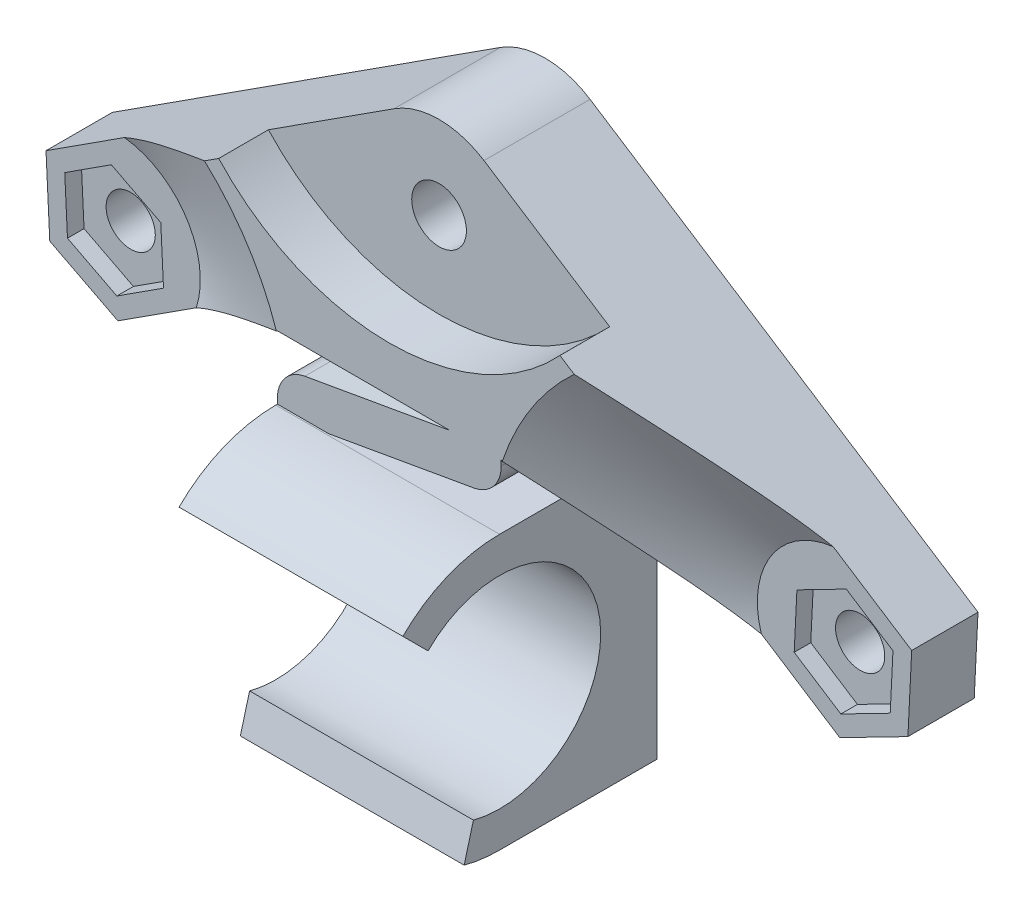
from build123d import *

# Parameters (mm, degrees)
BOSS_EXTRUDE1_DEPTH = 13.5
CUT_EXTRUDE1_DEPTH  = 19.454335534
SKETCH14_R          = 1.65
SKETCH14_R_2        = 1.483994527
BOSS_EXTRUDE3_DEPTH = 9.4
CUT_EXTRUDE7_DEPTH  = 43.344584395
FILLET2_R           = 2
CUT_EXTRUDE8_DEPTH  = 4
CUT_EXTRUDE9_DEPTH  = 5.4
CHAMFER2_SIZE       = 12
CHAMFER2_SIZE_2     = 6
CHAMFER3_SIZE       = 6
CHAMFER3_SIZE_2     = 12
SKETCH18_R          = 14.026707194
CUT_EXTRUDE10_DEPTH = 3
CUT_EXTRUDE11_DEPTH = 1


with BuildPart() as part:
    # Sketch1 → Boss-Extrude1 (new body)
    with BuildSketch(Plane.ZY):
        with BuildLine():
            Line((-9.5, 8.25), (-9.5, -8.25))
            Line((-9.5, -8.25), (0, -8.25))
            ThreePointArc((0, -8.25), (8.25, 0), (0, 8.25))
            Line((0, 8.25), (-9.5, 8.25))
        make_face()
    extrude(amount=BOSS_EXTRUDE1_DEPTH)

    # Sketch7 → Cut-Extrude1 (cut, through all)
    with BuildSketch(Plane.ZY.offset(13.5)):
        with BuildLine():
            Line((13.481907846, 13.481907846), (4.313351365, 4.313351365))
            ThreePointArc((4.313351365, 4.313351365), (-5.89214754, 1.578796175), (1.578796175, -5.89214754))
            Line((1.578796175, -5.89214754), (4.934720763, -18.416628609))
            Line((4.934720763, -18.416628609), (13.481907846, 13.481907846))
        make_face()
    extrude(amount=-CUT_EXTRUDE1_DEPTH, mode=Mode.SUBTRACT)

    # Sketch14 → Boss-Extrude3 (add)
    with BuildSketch(Plane(origin=(0, 0, -9.5), x_dir=(-1, 0, 0), z_dir=(0, 0, -1))):
        with BuildLine():
            Line((4.039848555, 24.201794753), (-19.358847021, 9.109670469))
            Line((-19.358847021, 9.109670469), (-19.131451731, 4.496469334))
            Line((-19.131451731, 4.496469334), (-15.022604709, 2.386798865))
            Line((-15.022604709, 2.386798865), (0, 12.07635684))
            Line((0, 12.07635684), (0, 8.25))
            Line((0, 8.25), (13.5, 8.25))
            Line((13.5, 8.25), (13.5, 12.07635684))
            Line((13.5, 12.07635684), (28.522604709, 2.386798865))
            Line((28.522604709, 2.386798865), (32.631451731, 4.496469334))
            Line((32.631451731, 4.496469334), (32.858847021, 9.109670469))
            Line((32.858847021, 9.109670469), (9.460151445, 24.201794753))
            ThreePointArc((9.460151445, 24.201794753), (6.75, 25), (4.039848555, 24.201794753))
        make_face()
        with Locations((6.75, 20)):
            Circle(SKETCH14_R, mode=Mode.SUBTRACT)
        with Locations((-15.25, 7)):
            Circle(SKETCH14_R_2, mode=Mode.SUBTRACT)
        with Locations(Location((28.75, 7, 0), (0, 0, 180))):
            Circle(SKETCH14_R_2, mode=Mode.SUBTRACT)
    extrude(amount=-BOSS_EXTRUDE3_DEPTH)

    # Sketch15 → Cut-Extrude7 (cut, through all)
    with BuildSketch(Plane.XY.offset(-0.1)):
        Polygon((0, 8.25), (-10.401710887, 8.25), (0, 10.084102275), align=None)
        Polygon((-13.5, 10.242254565), (-13.5, 12.07635684), (-3.098289113, 12.07635684), align=None)
    extrude(amount=-CUT_EXTRUDE7_DEPTH, mode=Mode.SUBTRACT)

    # Fillet2
    fillet2_edges = [part.edges().sort_by_distance(p)[0] for p in [
        (0, 10.084102275, -4.8),
        (-13.5, 10.242254565, -4.8),
    ]]
    fillet(fillet2_edges, radius=FILLET2_R)

    # Sketch16 → Cut-Extrude8 (cut)
    with BuildSketch(Plane(origin=(0, 0, -9.5), x_dir=(-1, 0, 0), z_dir=(0, 0, -1))):
        Polygon((6.75, 16.651368439), (9.65, 18.325684219), (9.65, 21.674315781), (6.75, 23.348631561), (3.85, 21.674315781), (3.85, 18.325684219), align=None)
    extrude(amount=-CUT_EXTRUDE8_DEPTH, mode=Mode.SUBTRACT)

    # Sketch17 → Cut-Extrude9 (cut)
    with BuildSketch(Plane.XY.offset(-0.1)):
        with BuildLine():
            Line((19.131451731, 4.496469334), (19.358847021, 9.109670469))
            Line((19.358847021, 9.109670469), (17.418121156, 10.361435802))
            ThreePointArc((17.418121156, 10.361435802), (11.888564198, 9.168121156), (13.081878844, 3.638564198))
            Line((13.081878844, 3.638564198), (15.022604709, 2.386798865))
            Line((15.022604709, 2.386798865), (19.131451731, 4.496469334))
        make_face()
        with BuildLine():
            Line((-32.631451731, 4.496469334), (-28.522604709, 2.386798865))
            Line((-28.522604709, 2.386798865), (-26.581878844, 3.638564198))
            ThreePointArc((-26.581878844, 3.638564198), (-25.388564198, 9.168121156), (-30.918121156, 10.361435802))
            Line((-30.918121156, 10.361435802), (-32.858847021, 9.109670469))
            Line((-32.858847021, 9.109670469), (-32.631451731, 4.496469334))
        make_face()
    extrude(amount=-CUT_EXTRUDE9_DEPTH, mode=Mode.SUBTRACT)

    # Chamfer2
    # the kernel refuses this chamfer: 12, 6 mm, written as the material it takes off along each edge
    with BuildSketch(Plane(origin=(-28.75, 7, -0.1), x_dir=(-0.8386519680093931, -0.5446676753342096, 0), z_dir=(-0.5446676753342096, 0.8386519680093931, 0))) as chamfer2_piece_1_section:
        Polygon((4 + CHAMFER2_SIZE, 0), (4, -CHAMFER2_SIZE_2), (4, 0), align=None)
    chamfer2_piece_1 = revolve(axis=Axis((-28.75, 7, -0.1), (0, 0, 1)), revolution_arc=359.64, mode=Mode.PRIVATE)
    chamfer2_piece_1 = split(chamfer2_piece_1, bisect_by=Plane(origin=(-24.520519127, 4.968138188, -1.544016366), z_dir=(-0.5420302889814643, 0.8403589505840171, 0)), keep=Keep.TOP, mode=Mode.PRIVATE)
    chamfer2_piece_1 = split(chamfer2_piece_1, bisect_by=Plane(origin=(-24.679235885, 5.214211241, -5.5), z_dir=(0, 0, 1)), keep=Keep.TOP, mode=Mode.PRIVATE)
    add(chamfer2_piece_1, mode=Mode.SUBTRACT)

    # Chamfer3
    # the kernel refuses this chamfer: 12, 6 mm, written as the material it takes off along each edge
    with BuildSketch(Plane(origin=(15.25, 7, -0.1), x_dir=(0.8420576391550663, -0.5393875530085916, 0), z_dir=(-0.5393875530085916, -0.8420576391550663, 0))) as chamfer3_piece_1_section:
        Polygon((4, -CHAMFER3_SIZE), (4 + CHAMFER3_SIZE_2, 0), (4, 0), align=None)
    chamfer3_piece_1 = revolve(axis=Axis((15.25, 7, -0.1), (0, 0, 1)), revolution_arc=359.64, mode=Mode.PRIVATE)
    chamfer3_piece_1 = split(chamfer3_piece_1, bisect_by=Plane(origin=(8.890128565, 11.795128101, -5.5), z_dir=(0, 0, 1)), keep=Keep.TOP, mode=Mode.PRIVATE)
    chamfer3_piece_1 = split(chamfer3_piece_1, bisect_by=Plane(origin=(0, 11.795128101, -1.99911645), z_dir=(1, 0, 0)), keep=Keep.TOP, mode=Mode.PRIVATE)
    add(chamfer3_piece_1, mode=Mode.SUBTRACT)

    # Sketch18 → Cut-Extrude10 (cut)
    with BuildSketch(Plane.XY.offset(-0.1)):
        with Locations((-6.75, 28.841468874)):
            Circle(SKETCH18_R)
    extrude(amount=-CUT_EXTRUDE10_DEPTH, mode=Mode.SUBTRACT)

    # Sketch19 → Cut-Extrude11 (cut)
    with BuildSketch(Plane.XY.offset(-5.5)):
        Polygon((-31.564052505, 5.184940267), (-28.585138414, 3.655429177), (-25.77108591, 5.47048891), (-25.935947495, 8.815059733), (-28.914861586, 10.344570823), (-31.72891409, 8.52951109), align=None)
        Polygon((18.064052505, 5.184940267), (18.22891409, 8.52951109), (15.414861586, 10.344570823), (12.435947495, 8.815059733), (12.27108591, 5.47048891), (15.085138414, 3.655429177), align=None)
    extrude(amount=-CUT_EXTRUDE11_DEPTH, mode=Mode.SUBTRACT)


solid = part.part
